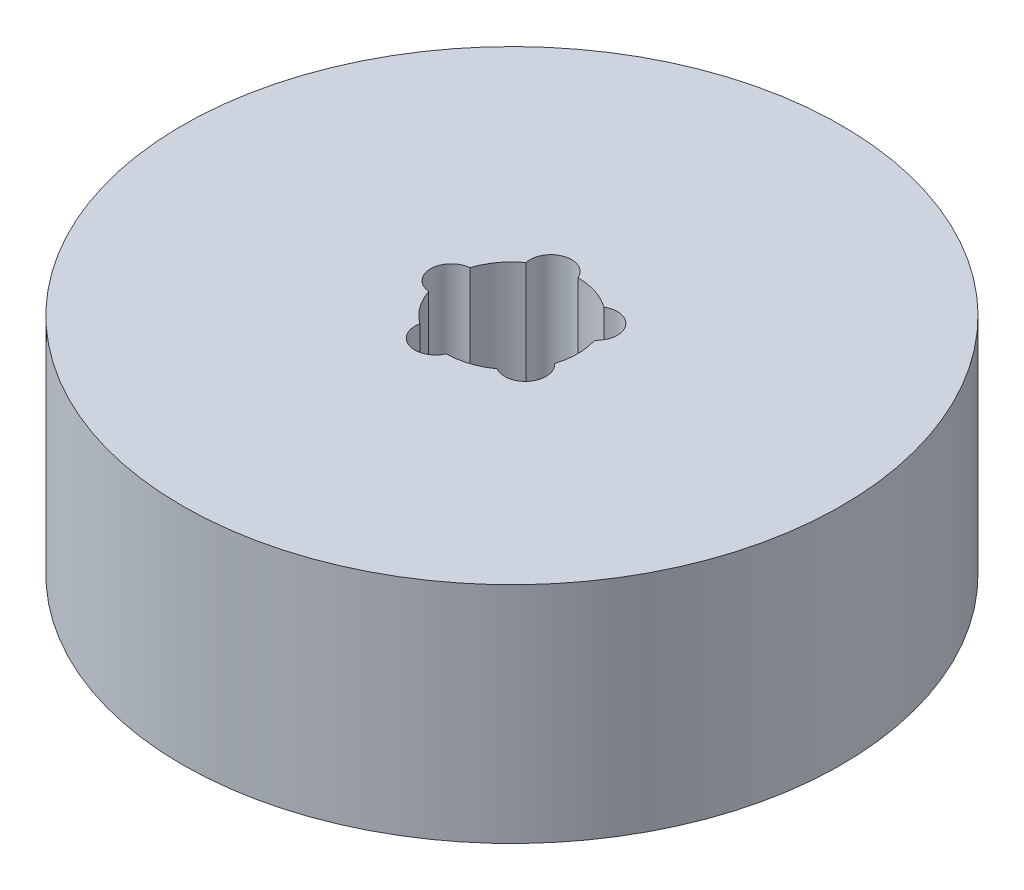
from build123d import *

# Parameters (mm, degrees)
SKETCH1_R           = 25
BOSS_EXTRUDE1_DEPTH = 17
SKETCH2_R           = 5
CUT_EXTRUDE1_DEPTH  = 40.230090492
SKETCH3_R           = 1.569607269
CUT_EXTRUDE2_DEPTH  = 11.485036093
CIRPATTERN1_COUNT   = 5


with BuildPart() as part:
    # Sketch1 → Boss-Extrude1 (new body)
    with BuildSketch(Plane(origin=(0, 0, 0), x_dir=(1, 0, 0), z_dir=(0, 1, 0))):
        Circle(SKETCH1_R)
    extrude(amount=BOSS_EXTRUDE1_DEPTH)

    # Sketch2 → Cut-Extrude1 (cut, through all)
    with BuildSketch(Plane(origin=(0, 0, 0), x_dir=(1, 0, 0), z_dir=(0, 1, 0))):
        Circle(SKETCH2_R)
    extrude(amount=CUT_EXTRUDE1_DEPTH, mode=Mode.SUBTRACT)

    # Sketch3 → Cut-Extrude2 (cut)
    with BuildSketch(Plane(origin=(0, 17, 0), x_dir=(1, 0, 0), z_dir=(0, 1, 0))):
        with Locations((-4.59979233, 0)):
            Circle(SKETCH3_R)
    cut_extrude2 = extrude(amount=-CUT_EXTRUDE2_DEPTH, mode=Mode.SUBTRACT)

    # CirPattern1: Cut-Extrude2 ×5 about axis
    cirpattern1_axis = Axis((0, 0, 0), (0, 1, 0))
    for i in range(1, CIRPATTERN1_COUNT):
        add(cut_extrude2.rotate(cirpattern1_axis, i * 360 / CIRPATTERN1_COUNT), mode=Mode.SUBTRACT)


solid = part.part
